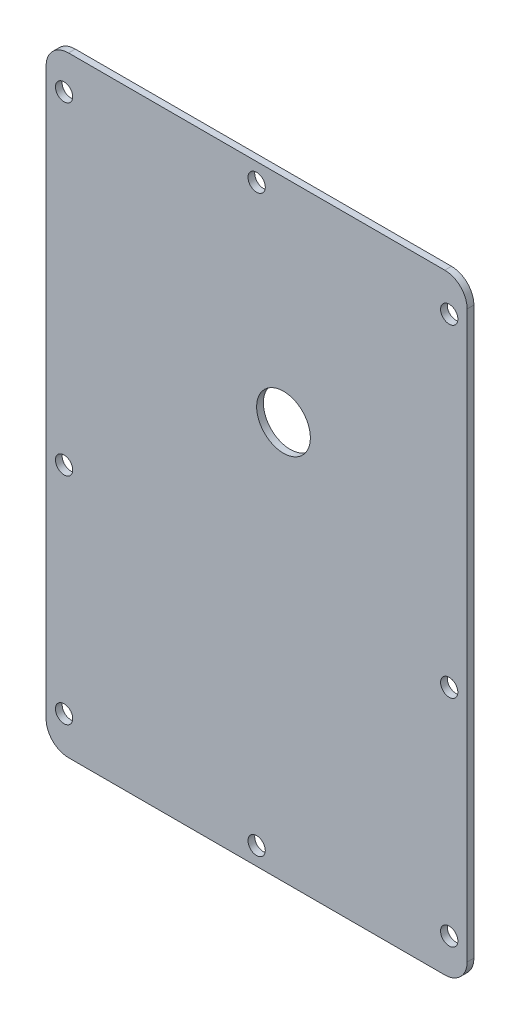
from build123d import *

# Parameters (mm, degrees)
SKETCH1_W                 = 94.03907037
SKETCH1_H                 = 136.332098139
BOSS_EXTRUDE1_DEPTH       = 1.5
FILLET1_R                 = 5
SKETCH_PATTERN1_START     = -1
SKETCH_PATTERN1_OUTLINE_R = 1.9304
SKETCH_PATTERN1_DEPTH     = 3
SKETCH4_R                 = 6
CUT_EXTRUDE2_DEPTH        = 136.031781017


with BuildPart() as part:
    # Sketch1 → Boss-Extrude1 (new body)
    with BuildSketch(Plane.XY):
        with Locations((0, 58.406045784)):
            Rectangle(SKETCH1_W, SKETCH1_H)
    extrude(amount=BOSS_EXTRUDE1_DEPTH)

    # Fillet1
    fillet1_edges = [part.edges().sort_by_distance(p)[0] for p in [
        (47.019535185, -9.760003286, 0.75),
        (-47.019535185, -9.760003286, 0.75),
        (-47.019535185, 126.572094853, 0.75),
        (47.019535185, 126.572094853, 0.75),
    ]]
    fillet(fillet1_edges, radius=FILLET1_R)

    # Sketch3 → #24 (0.152) Diameter Hole1 (revolve, cut)
    with BuildSketch(Plane(origin=(-43.009767592, 118.552559669, 1.5), x_dir=(0, -1, 0), z_dir=(1, 0, 0))):
        Polygon((0, 0), (0, 13.859901339), (1.9304, 12.7), (1.9304, 0), align=None)
    revolve(axis=Axis((-43.009767592, 118.552559669, 7.85), (0, 0, -1)), mode=Mode.SUBTRACT)

    # Sketch-Pattern1: read off the stored shape, not the designer's step
    # Sketch-Pattern1 outline → Sketch-Pattern1 (cut)
    with BuildSketch(Plane.XY.offset(SKETCH_PATTERN1_START)):
        with Locations((0, -5.750235693)):
            Circle(SKETCH_PATTERN1_OUTLINE_R)
        with Locations((0, 122.562327261)):
            Circle(SKETCH_PATTERN1_OUTLINE_R)
        with Locations((-43.009767592, -1.740468101)):
            Circle(SKETCH_PATTERN1_OUTLINE_R)
        with Locations((-43.009767592, 46.376743007)):
            Circle(SKETCH_PATTERN1_OUTLINE_R)
        with Locations((43.009767592, -1.740468101)):
            Circle(SKETCH_PATTERN1_OUTLINE_R)
        with Locations((43.009767592, 46.376743007)):
            Circle(SKETCH_PATTERN1_OUTLINE_R)
        with Locations((43.009767592, 118.552559669)):
            Circle(SKETCH_PATTERN1_OUTLINE_R)
    extrude(amount=SKETCH_PATTERN1_DEPTH, mode=Mode.SUBTRACT)

    # Sketch4 → Cut-Extrude2 (cut, through all)
    with BuildSketch(Plane.XY.offset(1.5)):
        with Locations((6.000018773, 79.140018508)):
            Circle(SKETCH4_R)
    extrude(amount=-CUT_EXTRUDE2_DEPTH, mode=Mode.SUBTRACT)


solid = part.part
